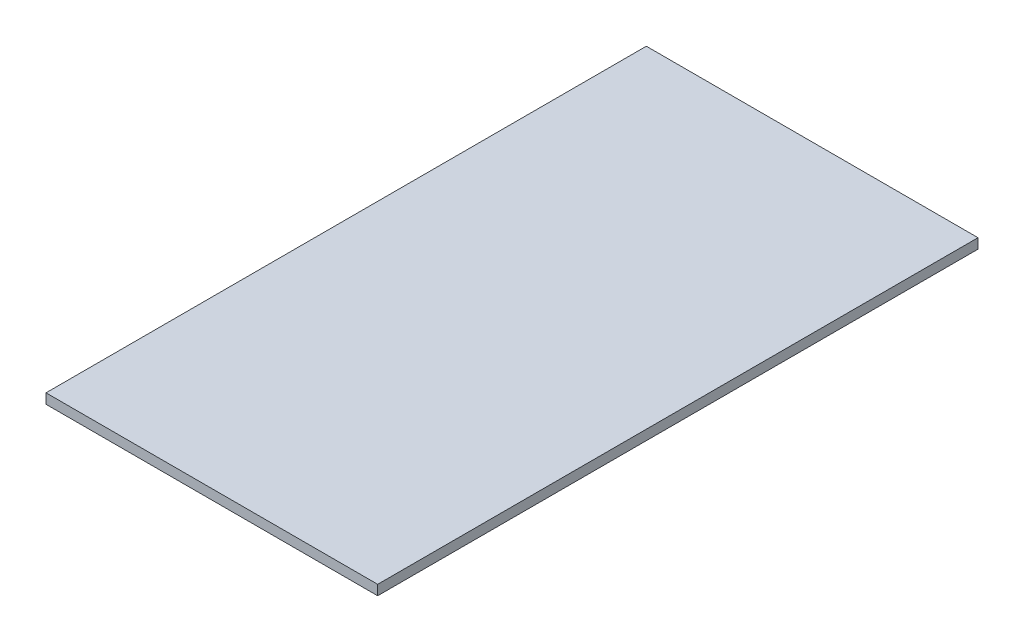
from build123d import *

# Parameters (mm, degrees)
SKETCH1_W           = 100
SKETCH1_H           = 181
BOSS_EXTRUDE1_DEPTH = 3


with BuildPart() as part:
    # Sketch1 → Boss-Extrude1 (new body)
    with BuildSketch(Plane(origin=(0, 0, 0), x_dir=(1, 0, 0), z_dir=(0, 1, 0))):
        with Locations((50, 90.5)):
            Rectangle(SKETCH1_W, SKETCH1_H)
    extrude(amount=BOSS_EXTRUDE1_DEPTH)


solid = part.part
